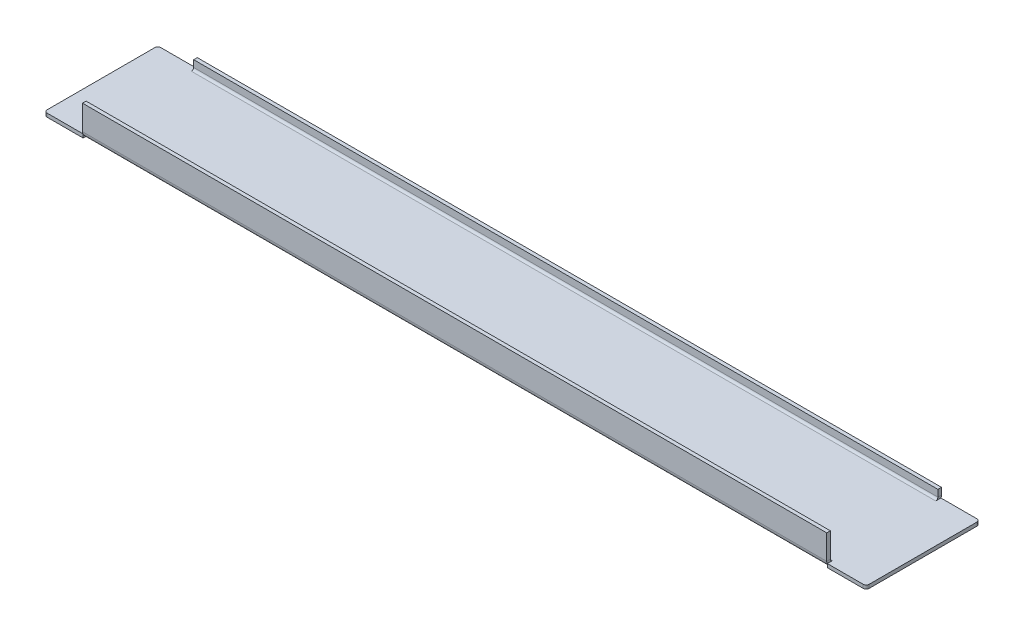
from build123d import *

# Parameters (mm, degrees)
FLANGE_BASE2_DEPTH       = 137.5
CORTE_EXTRUS_O3_START    = -137.5
CORTE_EXTRUS_O3_DEPTH    = 13
CORTE_EXTRUS_O3_START_2  = 124.5
CORTE_EXTRUS_O3_2_DEPTH  = 13
ESBO_O12_W               = 13
ESBO_O12_H               = 1.2
RESSALTO_EXTRUS_O1_DEPTH = 19
FILETE1_R                = 1


# Read off the part's stored shape, not the designer's step: Corte-extrusão3
# Sheet-metal steps are written as plain solids
with BuildPart() as part:
    # Esboço1 → Flange-base2 (new, symmetric)
    with BuildSketch(Plane(origin=(0, 0, 0), x_dir=(0, 0, -1), z_dir=(1, 0, 0))):
        with BuildLine():
            Line((-18, 9), (-18, 0.7366))
            ThreePointArc((-18, 0.7366), (-17.784254855, 0.215745145), (-17.2634, 0))
            Line((-17.2634, 0), (17.2634, 0))
            ThreePointArc((17.2634, 0), (17.784254855, 0.215745145), (18, 0.7366))
            Line((18, 0.7366), (18, 3))
            Line((18, 3), (19.2, 3))
            Line((19.2, 3), (19.2, 0.7366))
            ThreePointArc((19.2, 0.7366), (18.632782992, -0.632782992), (17.2634, -1.2))
            Line((17.2634, -1.2), (-17.2634, -1.2))
            ThreePointArc((-17.2634, -1.2), (-18.632782992, -0.632782992), (-19.2, 0.7366))
            Line((-19.2, 0.7366), (-19.2, 9))
            Line((-19.2, 9), (-18, 9))
        make_face()
    extrude(amount=FLANGE_BASE2_DEPTH, both=True)

    # Corte-extrusão3 outline → Corte-extrusão3 (cut)
    with BuildSketch(Plane.YZ.offset(CORTE_EXTRUS_O3_START)):
        with BuildLine():
            Line((-1.2, 17.2634), (0, 17.2634))
            ThreePointArc((0, 17.2634), (0.215745145, 17.784254855), (0.7366, 18))
            Line((0.7366, 18), (9, 18))
            Line((9, 18), (9, 19.2))
            Line((9, 19.2), (0.7366, 19.2))
            ThreePointArc((0.7366, 19.2), (-0.632782992, 18.632782992), (-1.2, 17.2634))
        make_face()
        with BuildLine():
            ThreePointArc((0.7366, -18), (0.215745145, -17.784254855), (0, -17.2634))
            Line((0, -17.2634), (-1.2, -17.2634))
            ThreePointArc((-1.2, -17.2634), (-0.632782992, -18.632782992), (0.7366, -19.2))
            Line((0.7366, -19.2), (3, -19.2))
            Line((3, -19.2), (3, -18))
            Line((3, -18), (0.7366, -18))
        make_face()
    extrude(amount=CORTE_EXTRUS_O3_DEPTH, mode=Mode.SUBTRACT)

    # Corte-extrus_o3 2 outline → Corte-extrus_o3 2 (cut)
    with BuildSketch(Plane.YZ.offset(CORTE_EXTRUS_O3_START_2)):
        with BuildLine():
            Line((-1.2, 17.2634), (0, 17.2634))
            ThreePointArc((0, 17.2634), (0.215745145, 17.784254855), (0.7366, 18))
            Line((0.7366, 18), (9, 18))
            Line((9, 18), (9, 19.2))
            Line((9, 19.2), (0.7366, 19.2))
            ThreePointArc((0.7366, 19.2), (-0.632782992, 18.632782992), (-1.2, 17.2634))
        make_face()
        with BuildLine():
            ThreePointArc((0.7366, -18), (0.215745145, -17.784254855), (0, -17.2634))
            Line((0, -17.2634), (-1.2, -17.2634))
            ThreePointArc((-1.2, -17.2634), (-0.632782992, -18.632782992), (0.7366, -19.2))
            Line((0.7366, -19.2), (3, -19.2))
            Line((3, -19.2), (3, -18))
            Line((3, -18), (0.7366, -18))
        make_face()
    extrude(amount=CORTE_EXTRUS_O3_2_DEPTH, mode=Mode.SUBTRACT)

    # Esboço12 → Ressalto-extrusão1 (add, symmetric)
    with BuildSketch(Plane.XY):
        with Locations((131, -0.6)):
            Rectangle(ESBO_O12_W, ESBO_O12_H)
        with Locations((-131, -0.6)):
            Rectangle(ESBO_O12_W, ESBO_O12_H)
    extrude(amount=RESSALTO_EXTRUS_O1_DEPTH, both=True)

    # Filete1
    filete1_edges = [part.edges().sort_by_distance(p)[0] for p in [
        (137.5, -0.6, -19),
        (137.5, -0.6, 19),
        (-137.5, -0.6, -19),
        (-137.5, -0.6, 19),
    ]]
    fillet(filete1_edges, radius=FILETE1_R)


solid = part.part
